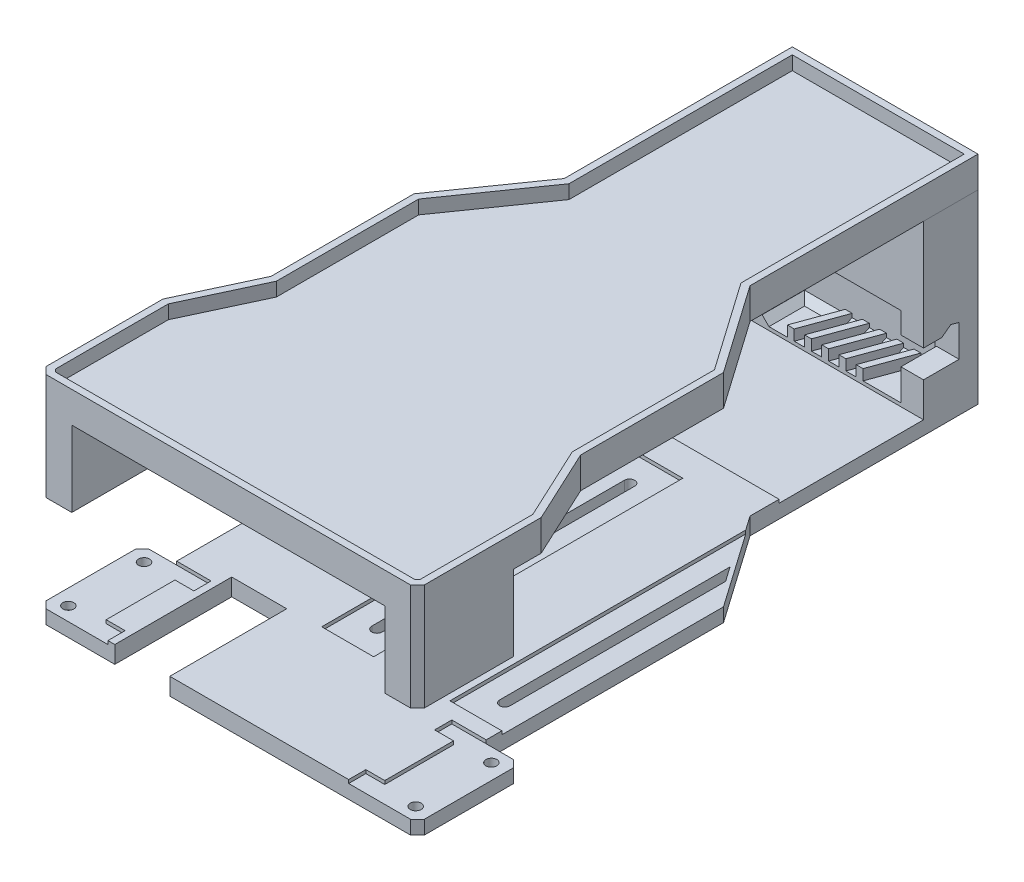
from build123d import *

# Parameters (mm, degrees)
SKETCH1_W                    = 90
SKETCH1_H                    = 190
BOSS_EXTRUDE1_DEPTH          = 5
SKETCH2_W                    = 10
SKETCH2_H                    = 30
BOSS_EXTRUDE2_DEPTH          = 5
CHAMFER1_SIZE                = 2
SKETCH3_W                    = 16
SKETCH3_H                    = 34
CUT_EXTRUDE1_DEPTH           = 50
SKETCH4_W                    = 90
SKETCH4_H                    = 42
CUT_EXTRUDE2_DEPTH           = 1
SKETCH7_W                    = 15.1
SKETCH7_H                    = 89.916335477
CUT_EXTRUDE7_DEPTH           = 1
BOSS_EXTRUDE4_START          = 5
BOSS_EXTRUDE4_DEPTH          = 13
BOSS_EXTRUDE5_DEPTH          = 3.1
CUT_EXTRUDE11_START          = 5
CUT_EXTRUDE11_DEPTH          = 1
CUT_EXTRUDE12_DEPTH          = 112.23848255
CUT_EXTRUDE12_DEPTH_BACK     = 112.23848255
BOSS_EXTRUDE6_DEPTH          = 1
CHAMFER4_SIZE                = 2
CUT_EXTRUDE13_REACH          = 114.094
SKETCH23_R                   = 1.5
CUT_EXTRUDE14_DEPTH          = 113.093556715
CUT_EXTRUDE14_DEPTH_BACK     = 113.093556715
SKETCH27_W                   = 2.002698481
SKETCH27_H                   = 10.340179912
BOSS_EXTRUDE7_DEPTH          = 8
BOSS_EXTRUDE10_DEPTH         = 8
BOSS_EXTRUDE11_OUTLINE_W     = 4.559976017
BOSS_EXTRUDE11_OUTLINE_H     = 15.84
BOSS_EXTRUDE11_DEPTH         = 13
BOSS_EXTRUDE12_DEPTH         = 12
SKETCH34_W                   = 46.940023983
SKETCH34_H                   = 1.75
BOSS_EXTRUDE13_DEPTH         = 12.34
SKETCH35_W                   = 6.562674498
SKETCH35_H                   = 5.170089956
BOSS_EXTRUDE14_DEPTH         = 15.25
SKETCH36_W                   = 6.562674498
SKETCH36_H                   = 8
CUT_EXTRUDE15_DEPTH          = 5.170089956
CHAMFER5_SIZE                = 8.360382376
CHAMFER5_SIZE_2              = 6.3
CHAMFER6_SIZE                = 3
CHAMFER6_SIZE2               = 2.492460212
SKETCH37_W                   = 6.562674498
SKETCH37_H                   = 5.170089956
BOSS_EXTRUDE15_DEPTH         = 1.075733433
BOSS_EXTRUDE16_START         = 24
BOSS_EXTRUDE16_DEPTH         = 5
BOSS_EXTRUDE17_DEPTH         = 4
SKETCH40_W                   = 54
SKETCH40_H                   = 15.84
BOSS_EXTRUDE18_DEPTH         = 24
BOSS_EXTRUDE19_START         = 32
BOSS_EXTRUDE19_DEPTH         = 22
SPLIT1_START                 = 54
SPLIT1_DEPTH                 = 5
SPLIT1_START_2               = 32
SPLIT1_2_DEPTH               = 22
SPLIT1_START_3               = 59
SPLIT1_3_DEPTH               = 4
SPLIT1_4_DEPTH               = 9
SPLIT1_5_DEPTH               = 22
BOSS_EXTRUDE20_DEPTH         = 4
CSK_FOR_M3_SFHCS1_AT_2_COUNT = 2
CSK_FOR_M3_SFHCS1_AT_2_PITCH = 22
CSK_FOR_M3_SFHCS1_AT_3_COUNT = 2
CSK_FOR_M3_SFHCS1_AT_3_PITCH = 103.368273663
CSK_FOR_M3_SFHCS1_AT_4_COUNT = 2
CSK_FOR_M3_SFHCS1_AT_4_PITCH = 101


# Read off the part's stored shape, not the designer's step: Boss-Extrude11, Split1
with BuildPart() as part:
    # Sketch1 → Boss-Extrude1 (new body)
    with BuildSketch(Plane(origin=(0, 0, 0), x_dir=(1, 0, 0), z_dir=(0, 1, 0))):
        Rectangle(SKETCH1_W, SKETCH1_H)
    extrude(amount=BOSS_EXTRUDE1_DEPTH)

    # Sketch2 → Boss-Extrude2 (add)
    with BuildSketch(Plane(origin=(0, 0, 0), x_dir=(1, 0, 0), z_dir=(0, 1, 0))):
        with Locations((-50, -80)):
            Rectangle(SKETCH2_W, SKETCH2_H)
        with Locations((50, -80)):
            Rectangle(SKETCH2_W, SKETCH2_H)
    extrude(amount=BOSS_EXTRUDE2_DEPTH)

    # Chamfer1
    chamfer1_edges = [part.edges().sort_by_distance(p)[0] for p in [
        (-55, 2.5, 65),
        (-55, 2.5, 95),
        (55, 2.5, 95),
        (55, 2.5, 65),
    ]]
    chamfer(chamfer1_edges, length=CHAMFER1_SIZE)

    # Sketch3 → Cut-Extrude1 (cut)
    with BuildSketch(Plane(origin=(0, 5, 0), x_dir=(1, 0, 0), z_dir=(0, 1, 0))):
        with Locations((-25, -78)):
            Rectangle(SKETCH3_W, SKETCH3_H)
    extrude(amount=-CUT_EXTRUDE1_DEPTH, mode=Mode.SUBTRACT)

    # Sketch4 → Cut-Extrude2 (cut)
    with BuildSketch(Plane(origin=(0, 5, 0), x_dir=(1, 0, 0), z_dir=(0, 1, 0))):
        with Locations((0, 59.159820088)):
            Rectangle(SKETCH4_W, SKETCH4_H)
    extrude(amount=-CUT_EXTRUDE2_DEPTH, mode=Mode.SUBTRACT)

    # Sketch7 → Cut-Extrude7 (cut)
    with BuildSketch(Plane(origin=(0, 5, 0), x_dir=(1, 0, 0), z_dir=(0, 1, 0))):
        with Locations((37.45, -15.495273531)):
            Rectangle(SKETCH7_W, SKETCH7_H)
        with Locations((0.16773297, -15.495273531)):
            Rectangle(SKETCH7_W, SKETCH7_H)
    extrude(amount=-CUT_EXTRUDE7_DEPTH, mode=Mode.SUBTRACT)

    # Sketch17 → Boss-Extrude4 (add)
    with BuildSketch(Plane(origin=(0, 0, 0), x_dir=(1, 0, 0), z_dir=(0, 1, 0)).offset(BOSS_EXTRUDE4_START)):
        Polygon((-22.440023983, 80.159820088), (-19.940023983, 80.159820088), (-19.940023983, 92.499820088), (18.940023983, 92.499820088), (19.940023983, 91.499820088), (19.940023983, 90.5), (22.440023983, 90.5), (22.440023983, 92.535353994), (19.975557889, 94.999820088), (-22.440023983, 94.999820088), align=None)
    extrude(amount=BOSS_EXTRUDE4_DEPTH)

    # Sketch18 → Boss-Extrude5 (add)
    with BuildSketch(Plane(origin=(0, 5, 0), x_dir=(1, 0, 0), z_dir=(0, 1, 0))):
        Polygon((-12.599634528, 80.159820088), (-10.599634528, 80.159820088), (-6.108241837, 92.499820088), (-8.108241837, 92.499820088), align=None)
        Polygon((-3.108241837, 92.499820088), (-7.599634528, 80.159820088), (-5.599634528, 80.159820088), (-1.108241837, 92.499820088), align=None)
        Polygon((1.891758163, 92.499820088), (-2.599634528, 80.159820088), (-0.599634528, 80.159820088), (3.891758163, 92.499820088), align=None)
        Polygon((6.891758163, 92.499820088), (2.400365472, 80.159820088), (4.400365472, 80.159820088), (8.891758163, 92.499820088), align=None)
        Polygon((11.891758163, 92.499820088), (7.400365472, 80.159820088), (9.400365472, 80.159820088), (13.891758163, 92.499820088), align=None)
    extrude(amount=BOSS_EXTRUDE5_DEPTH)

    # Sketch19 → Cut-Extrude11 (cut)
    with BuildSketch(Plane(origin=(0, 0, 0), x_dir=(1, 0, 0), z_dir=(0, 1, 0)).offset(CUT_EXTRUDE11_START)):
        Polygon((-35, -65), (-35, -70), (-40.5, -70), (-40.5, -90), (-35, -90), (-35, -95), (-53, -95), (-55, -93), (-55, -67), (-53, -65), align=None)
    cut_extrude11 = extrude(amount=-CUT_EXTRUDE11_DEPTH, mode=Mode.SUBTRACT)

    # Mirror1: Cut-Extrude11 across plane
    add(cut_extrude11.mirror(Plane(origin=(0, 0, 0), x_dir=(0, 0, 1), z_dir=(1, 0, 0))), mode=Mode.SUBTRACT)

    # Sketch20 → Cut-Extrude12 (cut, two sides: drawn at the far end of the back side and taken through both)
    with BuildSketch(Plane(origin=(0, 0, 0), x_dir=(1, 0, 0), z_dir=(0, 1, 0)).offset(-CUT_EXTRUDE12_DEPTH_BACK)):
        Polygon((-27, 29.706664121), (-45, 4), (-45, 95), (-27, 95), align=None)
        Polygon((27, 95), (27, 29.706664121), (45, 4), (45, 95), align=None)
    extrude(amount=CUT_EXTRUDE12_DEPTH + CUT_EXTRUDE12_DEPTH_BACK, mode=Mode.SUBTRACT)

    # Sketch22 → Boss-Extrude6 (add)
    with BuildSketch(Plane(origin=(0, 0, -94.999820088), x_dir=(-1, 0, 0), z_dir=(0, 0, -1))):
        Polygon((-19.975557889, 5), (-27, 5), (-27, 0), (27, 0), (27, 5), (22.440023983, 5), (22.440023983, 18), (-19.975557889, 18), align=None)
    extrude(amount=BOSS_EXTRUDE6_DEPTH)

    # Chamfer4
    chamfer4_edges = [part.edges().sort_by_distance(p)[0] for p in [
        (-19.940023983, 5, -86.329820088),
        (-14.02413291, 5, -92.499820088),
        (-4.608241837, 5, -92.499820088),
        (0.391758163, 5, -92.499820088),
        (5.391758163, 5, -92.499820088),
        (10.391758163, 5, -92.499820088),
    ]]
    chamfer(chamfer4_edges, length=CHAMFER4_SIZE)

    # Sketch23 → Cut-Extrude13 (cut, up to next)
    with BuildSketch(Plane.XZ, mode=Mode.PRIVATE) as cut_extrude13_sk1:
        with Locations(Location((-50.5, 91, 0), (0, 0, 270))):
            Circle(SKETCH23_R)
    cut_extrude13_tool1 = extrude(cut_extrude13_sk1.sketch, amount=-CUT_EXTRUDE13_REACH, mode=Mode.PRIVATE) & part.part
    # Sketch23 → Cut-Extrude13 (cut, up to next)
    with BuildSketch(Plane.XZ, mode=Mode.PRIVATE) as cut_extrude13_sk2:
        with Locations(Location((-50.5, 69, 0), (0, 0, 270))):
            Circle(SKETCH23_R)
    cut_extrude13_tool2 = extrude(cut_extrude13_sk2.sketch, amount=-CUT_EXTRUDE13_REACH, mode=Mode.PRIVATE) & part.part
    # Sketch23 → Cut-Extrude13 (cut, up to next)
    with BuildSketch(Plane.XZ, mode=Mode.PRIVATE) as cut_extrude13_sk3:
        with Locations(Location((50.5, 69, 0), (0, 0, 270))):
            Circle(SKETCH23_R)
    cut_extrude13_tool3 = extrude(cut_extrude13_sk3.sketch, amount=-CUT_EXTRUDE13_REACH, mode=Mode.PRIVATE) & part.part
    # Sketch23 → Cut-Extrude13 (cut, up to next)
    with BuildSketch(Plane.XZ, mode=Mode.PRIVATE) as cut_extrude13_sk4:
        with Locations(Location((50.5, 91, 0), (0, 0, 270))):
            Circle(SKETCH23_R)
    cut_extrude13_tool4 = extrude(cut_extrude13_sk4.sketch, amount=-CUT_EXTRUDE13_REACH, mode=Mode.PRIVATE) & part.part
    add(cut_extrude13_tool1.solids().sort_by_distance((-50.5, 0, 91))[0], mode=Mode.SUBTRACT)
    add(cut_extrude13_tool2.solids().sort_by_distance((-50.5, 0, 69))[0], mode=Mode.SUBTRACT)
    add(cut_extrude13_tool3.solids().sort_by_distance((50.5, 0, 69))[0], mode=Mode.SUBTRACT)
    add(cut_extrude13_tool4.solids().sort_by_distance((50.5, 0, 91))[0], mode=Mode.SUBTRACT)

    # Sketch25 → Cut-Extrude14 (cut, two sides: drawn at the far end of the back side and taken through both)
    with BuildSketch(Plane.XZ.offset(-CUT_EXTRUDE14_DEPTH_BACK)):
        with BuildLine():
            Line((1.71773297, 51.988728589), (1.71773297, -21.462894208))
            ThreePointArc((1.71773297, -21.462894208), (0.21773297, -22.962894208), (-1.28226703, -21.462894208))
            Line((-1.28226703, -21.462894208), (-1.28226703, 51.988728589))
            ThreePointArc((-1.28226703, 51.988728589), (0.21773297, 53.488728589), (1.71773297, 51.988728589))
        make_face()
        with BuildLine():
            Line((38.9, 51.988728589), (38.9, -21.462894208))
            ThreePointArc((38.9, -21.462894208), (37.4, -22.962894208), (35.9, -21.462894208))
            Line((35.9, -21.462894208), (35.9, 51.988728589))
            ThreePointArc((35.9, 51.988728589), (37.4, 53.488728589), (38.9, 51.988728589))
        make_face()
    extrude(amount=CUT_EXTRUDE14_DEPTH + CUT_EXTRUDE14_DEPTH_BACK, mode=Mode.SUBTRACT)

    # Sketch27 → Boss-Extrude7 (add)
    with BuildSketch(Plane(origin=(0, 5, 0), x_dir=(1, 0, 0), z_dir=(0, 1, 0))):
        with Locations((21.438674742, 85.329910044)):
            Rectangle(SKETCH27_W, SKETCH27_H)
    extrude(amount=BOSS_EXTRUDE7_DEPTH)

    # Sketch31 → Boss-Extrude10 (add)
    with BuildSketch(Plane(origin=(0, 5, 0), x_dir=(1, 0, 0), z_dir=(0, 1, 0))):
        Polygon((22.440023983, 92.535353994), (22.440023983, 80.159820088), (27, 80.159820088), (27, 95.999820088), (19.975557889, 95.999820088), (19.975557889, 94.999820088), align=None)
    extrude(amount=BOSS_EXTRUDE10_DEPTH)

    # Boss-Extrude11 outline → Boss-Extrude11 (add)
    with BuildSketch(Plane(origin=(0, 5, 0), x_dir=(1, 0, 0), z_dir=(0, 1, 0))):
        Polygon((22.440023983, 90.5), (27, 90.5), (27, 95.999820088), (19.975557889, 95.999820088), (19.975557889, 94.999820088), (22.440023983, 92.535353994), align=None)
        with Locations((-24.720011992, 88.079820088)):
            Rectangle(BOSS_EXTRUDE11_OUTLINE_W, BOSS_EXTRUDE11_OUTLINE_H)
    extrude(amount=BOSS_EXTRUDE11_DEPTH)

    # Sketch33 → Boss-Extrude12 (add)
    with BuildSketch(Plane(origin=(0, 18, 0), x_dir=(1, 0, 0), z_dir=(0, 1, 0))):
        Polygon((19.940023983, 90.5), (27, 90.5), (27, 95.999820088), (-27, 95.999820088), (-27, 80.159820088), (-19.940023983, 80.159820088), (-19.940023983, 92.499820088), (18.940023983, 92.499820088), (19.940023983, 91.499820088), align=None)
    extrude(amount=BOSS_EXTRUDE12_DEPTH)

    # Sketch34 → Boss-Extrude13 (add)
    with BuildSketch(Plane.XY.offset(-92.499820088)):
        with Locations((3.529988009, 29.125)):
            Rectangle(SKETCH34_W, SKETCH34_H)
    extrude(amount=BOSS_EXTRUDE13_DEPTH)

    # Sketch35 → Boss-Extrude14 (add)
    with BuildSketch(Plane(origin=(0, 13, 0), x_dir=(1, 0, 0), z_dir=(0, 1, 0))):
        with Locations((23.718662751, 82.744865066)):
            Rectangle(SKETCH35_W, SKETCH35_H)
    extrude(amount=BOSS_EXTRUDE14_DEPTH)

    # Sketch36 → Cut-Extrude15 (cut)
    with BuildSketch(Plane.XY.offset(-80.159820088)):
        with Locations((23.718662751, 18.075733433)):
            Rectangle(SKETCH36_W, SKETCH36_H)
    extrude(amount=-CUT_EXTRUDE15_DEPTH, mode=Mode.SUBTRACT)

    # Chamfer5
    # the kernel refuses this chamfer: 8.360382376, 6.3 mm, written as the material it adds along each edge
    with BuildSketch(Plane(origin=(27, 28.25, -85.329910044), x_dir=(0, 0.023321052992756976, -0.9997280272590685), z_dir=(-1, 0, 0))) as chamfer5_piece_1_section:
        Polygon((CHAMFER5_SIZE * 0.999728027284, CHAMFER5_SIZE * 0.0233210529933), (-CHAMFER5_SIZE_2 * 0.0233210529928, CHAMFER5_SIZE_2 * 0.999728027259), (0, 0), align=None)
    chamfer5_piece_1 = extrude(amount=6.562674498, mode=Mode.PRIVATE)
    chamfer5_piece_1 = split(chamfer5_piece_1, bisect_by=Plane(origin=(25.118661311, 22.075733433, -88.202521449), z_dir=(0, 1, 0)), keep=Keep.TOP, mode=Mode.PRIVATE)
    add(chamfer5_piece_1)

    # Chamfer6
    chamfer6_edges = [part.edges().sort_by_distance(p)[0] for p in [
        (23.718662751, 25.845942226, -90.5),
    ]]
    chamfer6_side = [part.faces().sort_by_distance(p)[0] for p in [
        (23.718662751, 23.960837829, -87.998381973),
    ]]
    chamfer(chamfer6_edges, length=CHAMFER6_SIZE, length2=CHAMFER6_SIZE2, reference=chamfer6_side[0])

    # Sketch37 → Boss-Extrude15 (add)
    with BuildSketch(Plane(origin=(0, 13, 0), x_dir=(1, 0, 0), z_dir=(0, 1, 0))):
        with Locations((23.718662751, 87.914955022)):
            Rectangle(SKETCH37_W, SKETCH37_H)
    extrude(amount=BOSS_EXTRUDE15_DEPTH)



with BuildPart() as body_2:
    # Sketch38 → Boss-Extrude16 (new body)
    with BuildSketch(Plane(origin=(0, 30, 0), x_dir=(1, 0, 0), z_dir=(0, 1, 0)).offset(BOSS_EXTRUDE16_START)):
        Polygon((-55, -59), (-55, -93), (-53, -95), (53, -95), (55, -93), (55, -59), (45, -37.554930795), (45, 4), (27, 29.706664121), (27, 95.999820088), (-27, 95.999820088), (-27, 29.706664121), (-45, 4), (-45, -37.554930795), align=None)
    extrude(amount=BOSS_EXTRUDE16_DEPTH)

    # Sketch39 → Boss-Extrude17 (add)
    with BuildSketch(Plane(origin=(0, 59, 0), x_dir=(1, 0, 0), z_dir=(0, 1, 0))):
        Polygon((55, -59), (45, -37.554930795), (45, 4), (27, 29.706664121), (27, 95.999820088), (-27, 95.999820088), (-27, 29.706664121), (-45, 4), (-45, -37.554930795), (-55, -59), (-55, -93), (-53, -95), (53, -95), (55, -93), align=None)
        Polygon((-43, -37.99832012), (-53, -59.443389325), (-53, -92.171572875), (-52.171572875, -93), (52.171572875, -93), (53, -92.171572875), (53, -59.443389325), (43, -37.99832012), (43, 3.369402422), (25, 29.076066544), (25, 93.999820088), (-25, 93.999820088), (-25, 29.076066544), (-43, 3.369402422), align=None, mode=Mode.SUBTRACT)
    extrude(amount=BOSS_EXTRUDE17_DEPTH)


with BuildPart() as part_1:
    add(part.part)

    add(body_2.part)  # Boss-Extrude18 merges body 2
    # Sketch40 → Boss-Extrude18 (add)
    with BuildSketch(Plane(origin=(0, 30, 0), x_dir=(1, 0, 0), z_dir=(0, 1, 0))):
        with Locations((0, 88.079820088)):
            Rectangle(SKETCH40_W, SKETCH40_H)
    extrude(amount=BOSS_EXTRUDE18_DEPTH)

    # Sketch41 → Boss-Extrude19 (add)
    with BuildSketch(Plane(origin=(0, 0, 0), x_dir=(1, 0, 0), z_dir=(0, 1, 0)).offset(BOSS_EXTRUDE19_START)):
        Polygon((-45.5, -65), (-53, -65), (-55, -67), (-55, -93), (-53, -95), (-45.5, -95), align=None)
        Polygon((45.5, -95), (53, -95), (55, -93), (55, -67), (53, -65), (45.5, -65), align=None)
    extrude(amount=BOSS_EXTRUDE19_DEPTH)

    # Split1 4 outline → Split1 4 (cut)
    with BuildSketch(Plane(origin=(0, 0, 0), x_dir=(1, 0, 0), z_dir=(0, 1, 0)).offset(SPLIT1_START)):
        Polygon((27, 29.706664121), (27, 95.999820088), (-27, 95.999820088), (-27, 29.706664121), (-45, 4), (-45, -37.554930795), (-55, -59), (-55, -93), (-53, -95), (53, -95), (55, -93), (55, -59), (45, -37.554930795), (45, 4), align=None)
    extrude(amount=SPLIT1_4_DEPTH, mode=Mode.SUBTRACT)

    # Split1 5 outline → Split1 5 (cut)
    with BuildSketch(Plane(origin=(0, 0, 0), x_dir=(1, 0, 0), z_dir=(0, 1, 0)).offset(SPLIT1_START_2)):
        Polygon((55, -93), (55, -67), (53, -65), (45.5, -65), (45.5, -95), (53, -95), align=None)
        Polygon((-53, -65), (-55, -67), (-55, -93), (-53, -95), (-45.5, -95), (-45.5, -65), align=None)
    extrude(amount=SPLIT1_5_DEPTH, mode=Mode.SUBTRACT)

    # Sketch43 → Boss-Extrude20 (add)
    with BuildSketch(Plane.XZ):
        Polygon((35.9, -14.996146861), (38.9, -10.711702841), (38.9, -12.711702841), (35.9, -16.996146861), align=None)
    extrude(amount=-BOSS_EXTRUDE20_DEPTH)

    # Sketch45 → CSK for M3 SFHCS1 (revolve, cut)
    with BuildSketch(Plane(origin=(50.5, 0, 91), x_dir=(0, 0, -1), z_dir=(1, 0, 0))):
        Polygon((0, 0), (0, 32), (1.6, 31.03862301), (1.6, 1.76), (3.36, 0), align=None)
    csk_for_m3_sfhcs1 = revolve(axis=Axis((50.5, -6.35, 91), (0, 1, 0)), mode=Mode.SUBTRACT)

    # CSK for M3 SFHCS1 at 2: CSK for M3 SFHCS1 ×2
    with Locations(*[(0, 0, -i * CSK_FOR_M3_SFHCS1_AT_2_PITCH) for i in range(1, CSK_FOR_M3_SFHCS1_AT_2_COUNT)]):
        add(csk_for_m3_sfhcs1, mode=Mode.SUBTRACT)

    # CSK for M3 SFHCS1 at 3: CSK for M3 SFHCS1 ×2
    with Locations(*[Vector(-0.9770889695769172, 0, -0.21283126069992253) * (i * CSK_FOR_M3_SFHCS1_AT_3_PITCH) for i in range(1, CSK_FOR_M3_SFHCS1_AT_3_COUNT)]):
        add(csk_for_m3_sfhcs1, mode=Mode.SUBTRACT)

    # CSK for M3 SFHCS1 at 4: CSK for M3 SFHCS1 ×2
    with Locations(*[(-i * CSK_FOR_M3_SFHCS1_AT_4_PITCH, 0, 0) for i in range(1, CSK_FOR_M3_SFHCS1_AT_4_COUNT)]):
        add(csk_for_m3_sfhcs1, mode=Mode.SUBTRACT)


with BuildPart() as body_2_2:
    # Split1 outline → Split1 (new body)
    with BuildSketch(Plane(origin=(0, 0, 0), x_dir=(1, 0, 0), z_dir=(0, 1, 0)).offset(SPLIT1_START)):
        Polygon((-53, -95), (53, -95), (55, -93), (55, -59), (45, -37.554930795), (45, 4), (27, 29.706664121), (27, 95.999820088), (-27, 95.999820088), (-27, 29.706664121), (-45, 4), (-45, -37.554930795), (-55, -59), (-55, -93), align=None)
    extrude(amount=SPLIT1_DEPTH)

    # Split1 2 outline → Split1 2 (add)
    with BuildSketch(Plane(origin=(0, 0, 0), x_dir=(1, 0, 0), z_dir=(0, 1, 0)).offset(SPLIT1_START_2)):
        Polygon((-45.5, -95), (-45.5, -65), (-53, -65), (-55, -67), (-55, -93), (-53, -95), align=None)
        Polygon((45.5, -65), (45.5, -95), (53, -95), (55, -93), (55, -67), (53, -65), align=None)
    extrude(amount=SPLIT1_2_DEPTH)

    # Split1 3 outline → Split1 3 (add)
    with BuildSketch(Plane(origin=(0, 0, 0), x_dir=(1, 0, 0), z_dir=(0, 1, 0)).offset(SPLIT1_START_3)):
        Polygon((-53, -95), (53, -95), (55, -93), (55, -59), (45, -37.554930795), (45, 4), (27, 29.706664121), (27, 95.999820088), (-27, 95.999820088), (-27, 29.706664121), (-45, 4), (-45, -37.554930795), (-55, -59), (-55, -93), align=None)
        Polygon((-52.171572875, -93), (-53, -92.171572875), (-53, -59.443389325), (-43, -37.99832012), (-43, 3.369402422), (-25, 29.076066544), (-25, 93.999820088), (25, 93.999820088), (25, 29.076066544), (43, 3.369402422), (43, -37.99832012), (53, -59.443389325), (53, -92.171572875), (52.171572875, -93), align=None, mode=Mode.SUBTRACT)
    extrude(amount=SPLIT1_3_DEPTH)


solid = Compound([part_1.part, body_2_2.part])
